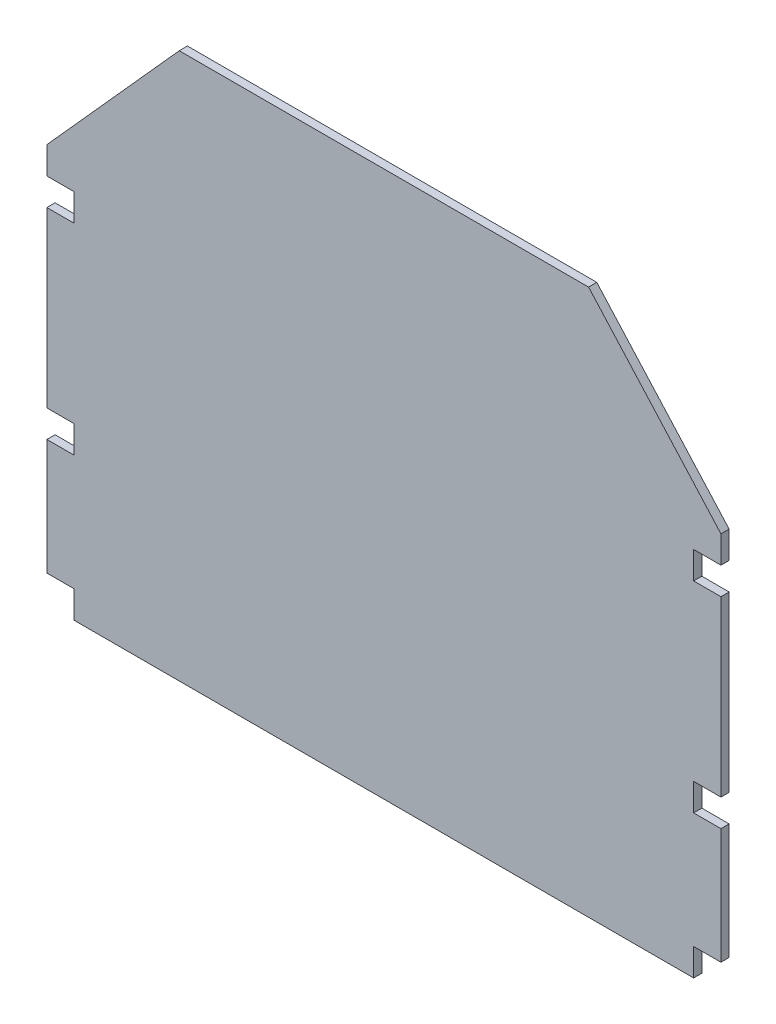
from build123d import *

# Parameters (mm, degrees)
BOSS_EXTRU_1_DEPTH      = 3
ENL_V_MAT_EXTRU_1_DEPTH = 345.268848431
ESQUISSE4_W             = 10
ESQUISSE4_H             = 10
ENL_V_MAT_EXTRU_2_DEPTH = 331.898715622


with BuildPart() as part:
    # Esquisse1 → Boss.-Extru.1 (new body)
    with BuildSketch(Plane.XY):
        Polygon((0, 0), (0, 127.45), (65.1, 200), (215.1, 200), (280.2, 127.45), (280.2, 0), align=None)
    extrude(amount=BOSS_EXTRU_1_DEPTH)

    # Esquisse2 → Enlèv. mat.-Extru.1 (cut, through all)
    with BuildSketch(Plane(origin=(0, 0, 0), x_dir=(-1, 0, 0), z_dir=(0, 0, -1))):
        Polygon((-16.6, 0), (-16.6, 145.969439351), (0, 127.45), (0, 0), align=None)
        Polygon((-280.2, 127.45), (-263.6, 145.969439351), (-263.6, 0), (-280.2, 0), align=None)
    extrude(amount=-ENL_V_MAT_EXTRU_1_DEPTH, mode=Mode.SUBTRACT)

    # Esquisse4 → Enlèv. mat.-Extru.2 (cut, through all)
    with BuildSketch(Plane.XY.offset(3)):
        with Locations((21.6, 5)):
            Rectangle(ESQUISSE4_W, ESQUISSE4_H)
        with Locations((21.6, 57.4)):
            Rectangle(ESQUISSE4_W, ESQUISSE4_H)
        with Locations((258.6, 131)):
            Rectangle(ESQUISSE4_W, ESQUISSE4_H)
        with Locations((21.6, 131)):
            Rectangle(ESQUISSE4_W, ESQUISSE4_H)
        with Locations((258.6, 57.4)):
            Rectangle(ESQUISSE4_W, ESQUISSE4_H)
        with Locations((258.6, 5)):
            Rectangle(ESQUISSE4_W, ESQUISSE4_H)
    extrude(amount=-ENL_V_MAT_EXTRU_2_DEPTH, mode=Mode.SUBTRACT)


solid = part.part
